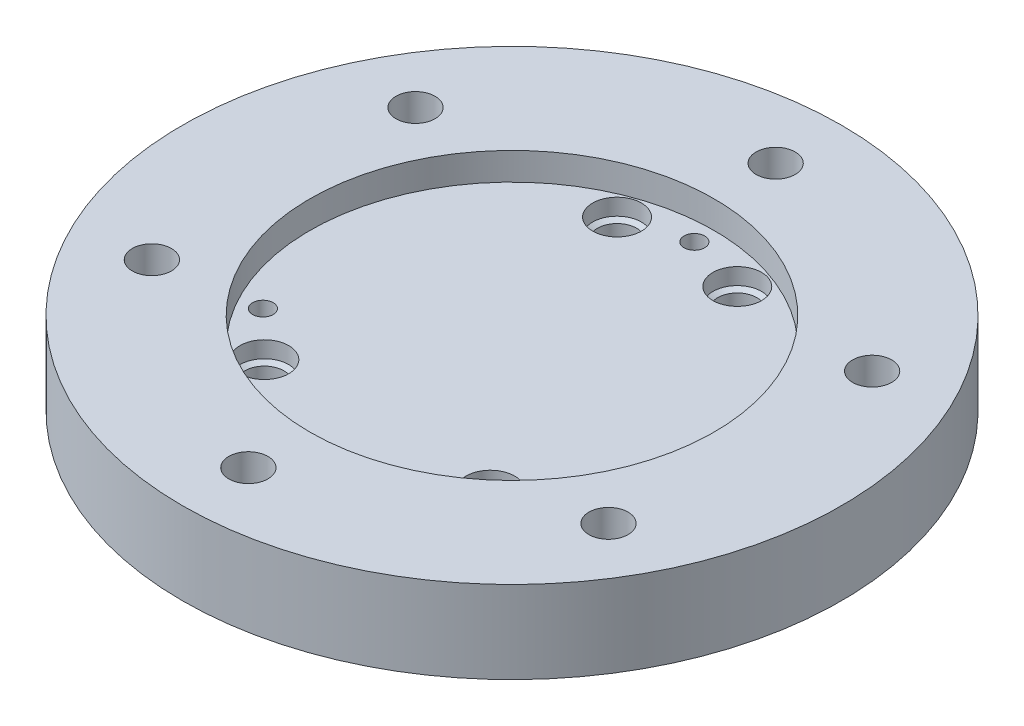
from build123d import *

# Parameters (mm, degrees)
OUTER_R                     = 19.05
BODY_DEPTH                  = 4.7625
INNER_R                     = 11.684
POCKET_DEPTH                = 1.5875
F_4_40_TAPPED_HOLE3_D       = 2.2606
SCREW_HOLES_COUNT           = 6
F_0_80_TAPPED_HOLE1_D       = 1.19126
INNER_SCREW_HOLES_COUNT     = 3
F_43_0_089_DIAMETER_HOLE1_D = 2.2606


with BuildPart() as part:
    # outer → Body (new body)
    with BuildSketch(Plane(origin=(0, 0, 0), x_dir=(1, 0, 0), z_dir=(0, 1, 0))):
        Circle(OUTER_R)
    extrude(amount=-BODY_DEPTH)

    # inner → Pocket (cut)
    with BuildSketch(Plane(origin=(0, 0, 0), x_dir=(1, 0, 0), z_dir=(0, 1, 0))):
        Circle(INNER_R)
    extrude(amount=-POCKET_DEPTH, mode=Mode.SUBTRACT)

    # #4-40 Tapped Hole3 (through all)
    with Locations(Plane(origin=(0, 0, 0), x_dir=(1, 0, 0), z_dir=(0, 1, 0))):
        with Locations((0, -15.24)):
            f_4_40_tapped_hole3 = Hole(F_4_40_TAPPED_HOLE3_D / 2)

    # Screw Holes: #4-40 Tapped Hole3 ×6 about axis
    screw_holes_axis = Axis((0, 0.15875, 0), (0, -1, 0))
    for i in range(1, SCREW_HOLES_COUNT):
        add(f_4_40_tapped_hole3.rotate(screw_holes_axis, i * 360 / SCREW_HOLES_COUNT), mode=Mode.SUBTRACT)

    # #0-80 Tapped Hole1 (through all)
    with Locations(Plane(origin=(0, -1.5875, 0), x_dir=(1, 0, 0), z_dir=(0, 1, 0))):
        with Locations((0, 10.541)):
            f_0_80_tapped_hole1 = Hole(F_0_80_TAPPED_HOLE1_D / 2)

    # Inner Screw Holes: #0-80 Tapped Hole1 ×3 about axis
    inner_screw_holes_axis = Axis((0, 0.15875, 0), (0, -1, 0))
    for i in range(1, INNER_SCREW_HOLES_COUNT):
        add(f_0_80_tapped_hole1.rotate(inner_screw_holes_axis, i * 360 / INNER_SCREW_HOLES_COUNT), mode=Mode.SUBTRACT)

    # #43 (0.089) Diameter Hole1 (through all)
    with Locations(Plane(origin=(0, -1.5875, 0), x_dir=(1, 0, 0), z_dir=(0, 1, 0))):
        with Locations((-3.474924656, 9.547277027)):
            f_43_0_089_diameter_hole1 = Hole(F_43_0_089_DIAMETER_HOLE1_D / 2)

    # Sketch23 → #34 (0.111) Diameter Hole1 (revolve, cut)
    with BuildSketch(Plane(origin=(-3.474924656, -1.5875, -9.547277027), x_dir=(0, 0, 1), z_dir=(1, 0, 0))):
        Polygon((0, 0), (0, 1.799533215), (1.4097, 0.9525), (1.4097, 0), align=None)
    f_34_0_111_diameter_hole1 = revolve(axis=Axis((-3.474924656, 4.7625, -9.547277027), (0, -1, 0)), mode=Mode.SUBTRACT)

    # Sketch27 → #34 (0.111) Diameter Hole2 (revolve, cut)
    with BuildSketch(Plane(origin=(-3.474924656, -4.7625, -9.547277027), x_dir=(0, 0, -1), z_dir=(1, 0, 0))):
        Polygon((0, 0), (0, 1.799533215), (1.4097, 0.9525), (1.4097, 0), align=None)
    f_34_0_111_diameter_hole2 = revolve(axis=Axis((-3.474924656, -11.1125, -9.547277027), (0, 1, 0)), mode=Mode.SUBTRACT)

    # IO Holes Pattern: #43 (0.089) Diameter Hole1, #34 (0.111) Diameter Hole1, #34 (0.111) Diameter Hole2 at 3 more places
    with Locations((6.949849, 0, 0), (-3.055797, 0, 17.330289), (10.005647, 0, 17.330289)):
        add(f_43_0_089_diameter_hole1, mode=Mode.SUBTRACT)
        add(f_34_0_111_diameter_hole1, mode=Mode.SUBTRACT)
        add(f_34_0_111_diameter_hole2, mode=Mode.SUBTRACT)


solid = part.part
